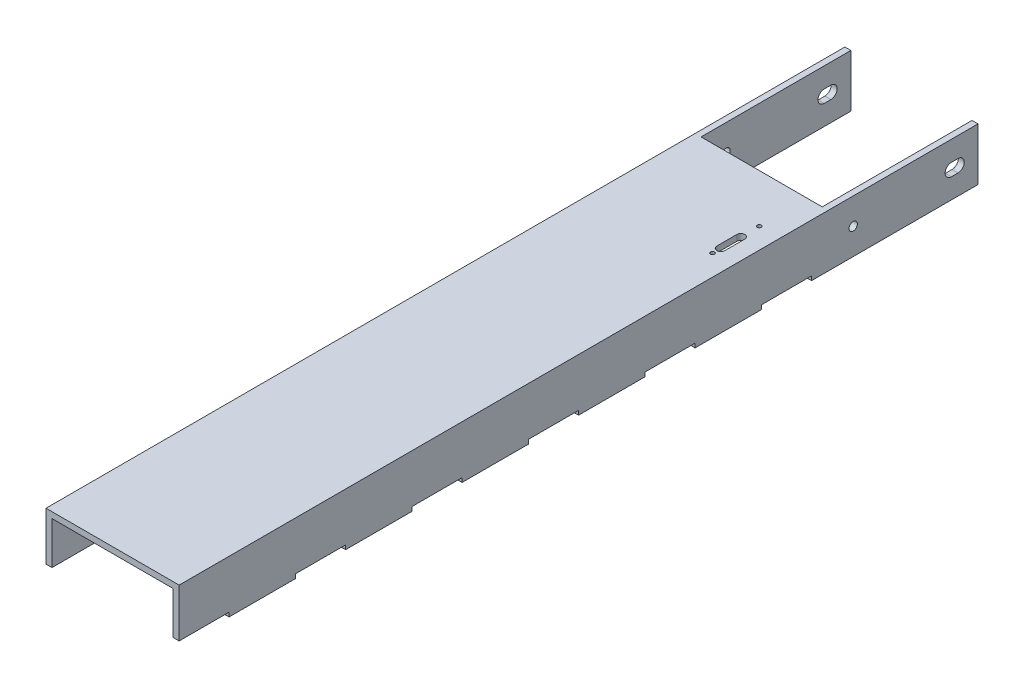
from build123d import *

# Parameters (mm, degrees)
BOSS_EXTRUDE1_DEPTH = 609.6
SKETCH3_R           = 1.524
SKETCH3_W           = 92.456
SKETCH3_H           = 114.3
CUT_EXTRUDE1_DEPTH  = 614.028039672
SKETCH4_R           = 3.175
SKETCH4_W           = 38.1
SKETCH4_H           = 3.175
CUT_EXTRUDE2_DEPTH  = 620.310340156


with BuildPart() as part:
    # Sketch1 → Boss-Extrude1 (new body)
    with BuildSketch(Plane.XY):
        Polygon((-50.8, 0), (50.8, 0), (50.8, -40.132), (46.228, -40.132), (46.228, -4.572), (-46.228, -4.572), (-46.228, -40.132), (-50.8, -40.132), align=None)
    extrude(amount=BOSS_EXTRUDE1_DEPTH)

    # Sketch3 → Cut-Extrude1 (cut, through all)
    with BuildSketch(Plane(origin=(0, 0, 0), x_dir=(1, 0, 0), z_dir=(0, 1, 0))):
        with Locations((34.925, -151.13)):
            Circle(SKETCH3_R)
        with Locations((34.925, -186.69)):
            Circle(SKETCH3_R)
        with Locations((0, -57.15)):
            Rectangle(SKETCH3_W, SKETCH3_H)
        with BuildLine():
            Line((37.973, -165.1), (37.973, -180.34))
            ThreePointArc((37.973, -180.34), (34.925, -183.388), (31.877, -180.34))
            Line((31.877, -180.34), (31.877, -165.1))
            ThreePointArc((31.877, -165.1), (34.925, -162.052), (37.973, -165.1))
        make_face()
    extrude(amount=-CUT_EXTRUDE1_DEPTH, mode=Mode.SUBTRACT)

    # Sketch4 → Cut-Extrude2 (cut, through all)
    with BuildSketch(Plane(origin=(50.8, 0, 0), x_dir=(0, 0, -1), z_dir=(1, 0, 0))):
        with Locations((-95.25, -20.066)):
            Circle(SKETCH4_R)
        with BuildLine():
            Line((-15.24, -24.8285), (-20.32, -24.8285))
            ThreePointArc((-20.32, -24.8285), (-25.0825, -20.066), (-20.32, -15.3035))
            Line((-20.32, -15.3035), (-15.24, -15.3035))
            ThreePointArc((-15.24, -15.3035), (-10.4775, -20.066), (-15.24, -24.8285))
        make_face()
        with Locations((-501.65, -38.5445)):
            Rectangle(SKETCH4_W, SKETCH4_H)
        with Locations((-590.55, -38.5445)):
            Rectangle(SKETCH4_W, SKETCH4_H)
        with Locations((-412.75, -38.5445)):
            Rectangle(SKETCH4_W, SKETCH4_H)
        with Locations((-323.85, -38.5445)):
            Rectangle(SKETCH4_W, SKETCH4_H)
        with Locations((-234.95, -38.5445)):
            Rectangle(SKETCH4_W, SKETCH4_H)
        with Locations((-146.05, -38.5445)):
            Rectangle(SKETCH4_W, SKETCH4_H)
    extrude(amount=-CUT_EXTRUDE2_DEPTH, mode=Mode.SUBTRACT)


solid = part.part
